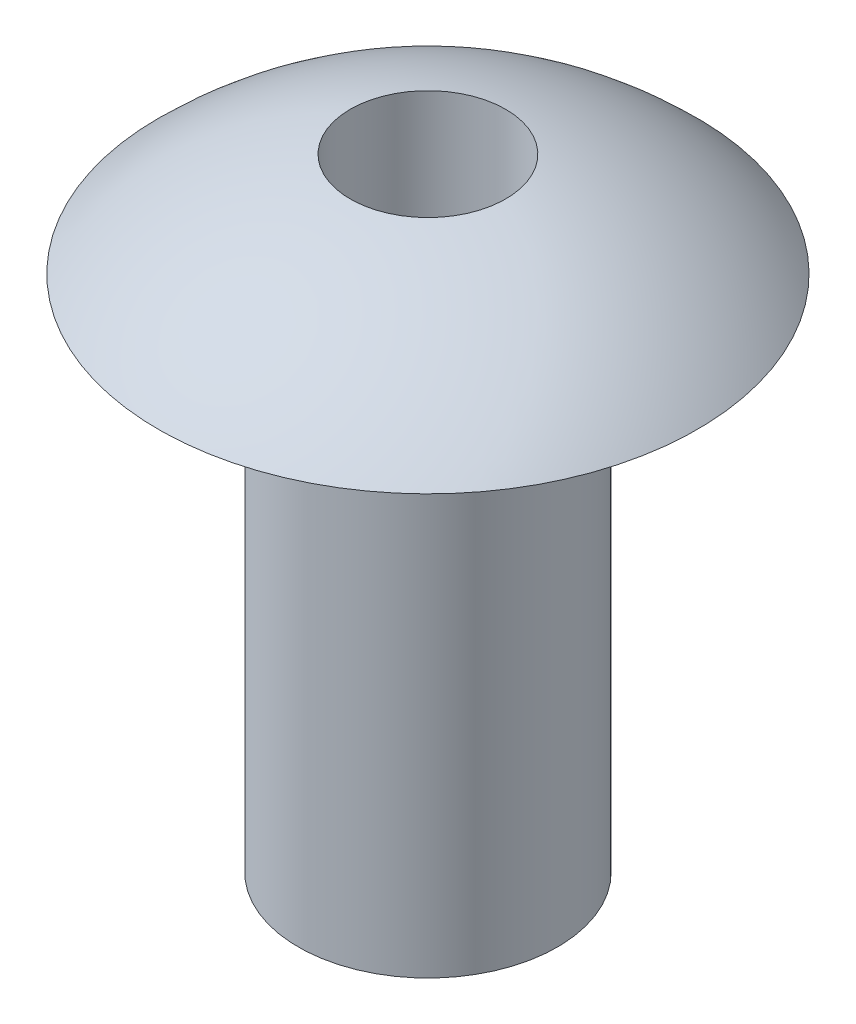
from build123d import *


with BuildPart() as part:
    # 草图1 → 旋转1 (revolve)
    with BuildSketch(Plane.XY):
        with BuildLine():
            Line((0, -2.8815), (-1.5, -2.8815))
            Line((-1.5, -2.8815), (-1.5, 3.1185))
            Line((-1.5, 3.1185), (-3.12, 3.1185))
            ThreePointArc((-3.12, 3.1185), (-2.097641533, 3.880636836), (-0.9, 4.3185))
            Line((-0.9, 4.3185), (-0.9, 1.9185))
            Line((-0.9, 1.9185), (0, 1.9185))
            Line((0, 1.9185), (0, -2.8815))
        make_face()
    revolve(axis=Axis((0, -2.8815, 0), (0, 1, 0)))


solid = part.part
